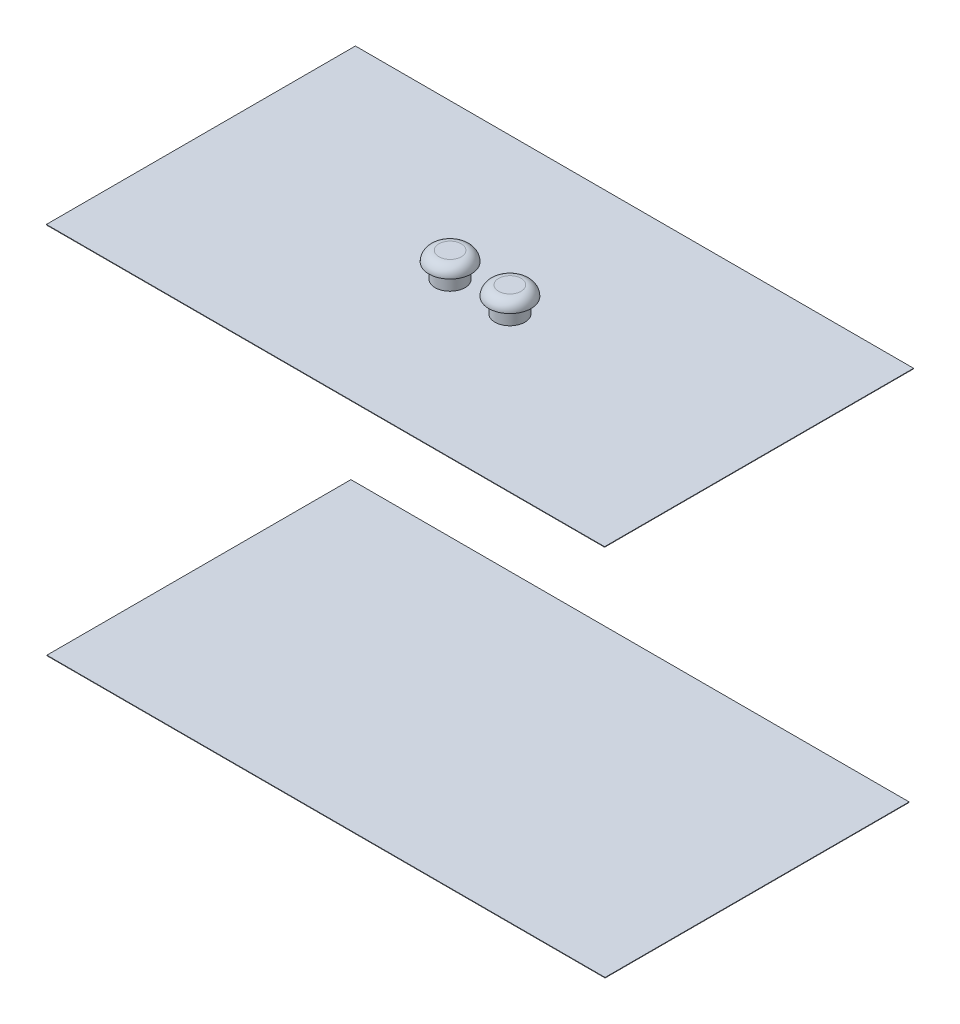
from build123d import *

# Parameters (mm, degrees)
SKETCH2_W           = 1120
SKETCH2_H           = 610
BASE_FLANGE1_DEPTH  = 1
SKETCH8_W           = 560
SKETCH8_H           = 620
BASE_FLANGE2_DEPTH  = 1
SKETCH11_W          = 560
SKETCH11_H          = 620
BASE_FLANGE3_DEPTH  = 1
SKETCH14_R          = 30
BOSS_EXTRUDE1_DEPTH = 30
SKETCH17_R          = 42.5
BOSS_EXTRUDE2_DEPTH = 20
FILLET1_R           = 20


# Sheet-metal steps are written as plain solids
with BuildPart() as part:
    # Sketch2 → Base-Flange1 (new body)
    with BuildSketch(Plane.XZ.offset(375)):
        with Locations((0, -306)):
            Rectangle(SKETCH2_W, SKETCH2_H)
    extrude(amount=-BASE_FLANGE1_DEPTH)


with BuildPart() as body_2:
    # Sketch8 → Base-Flange2 (new body)
    with BuildSketch(Plane(origin=(0, 375, 0), x_dir=(1, 0, 0), z_dir=(0, 1, 0))):
        with Locations((-280, 310)):
            Rectangle(SKETCH8_W, SKETCH8_H)
    extrude(amount=-BASE_FLANGE2_DEPTH)



with BuildPart() as body_3:
    # Sketch11 → Base-Flange3 (new body)
    with BuildSketch(Plane(origin=(0, 375, 0), x_dir=(1, 0, 0), z_dir=(0, 1, 0))):
        with Locations((280, 310)):
            Rectangle(SKETCH11_W, SKETCH11_H)
    extrude(amount=-BASE_FLANGE3_DEPTH)


with BuildPart() as body_2_1:
    add(body_2.part)

    add(body_3.part)  # Boss-Extrude1 merges body 3
    # Sketch14 → Boss-Extrude1 (add)
    with BuildSketch(Plane(origin=(0, 375, 0), x_dir=(1, 0, 0), z_dir=(0, 1, 0))):
        with Locations(Location((-60, 310, 0), (0, 0, 270))):
            Circle(SKETCH14_R)
        with Locations(Location((60, 310, 0), (0, 0, 270))):
            Circle(SKETCH14_R)
    extrude(amount=BOSS_EXTRUDE1_DEPTH)

    # Sketch17 → Boss-Extrude2 (add)
    with BuildSketch(Plane(origin=(0, 405, 0), x_dir=(1, 0, 0), z_dir=(0, 1, 0))):
        with Locations(Location((-60, 310, 0), (0, 0, 270))):
            Circle(SKETCH17_R)
        with Locations(Location((60, 310, 0), (0, 0, 270))):
            Circle(SKETCH17_R)
    extrude(amount=BOSS_EXTRUDE2_DEPTH)

    # Fillet1
    fillet1_edges = [body_2_1.edges().sort_by_distance(p)[0] for p in [
        (-60, 425, -352.5),
        (60, 425, -352.5),
    ]]
    fillet(fillet1_edges, radius=FILLET1_R - 0.0001)  # a hair under: the kernel refuses the full size


solid = Compound([part.part, body_2_1.part])
